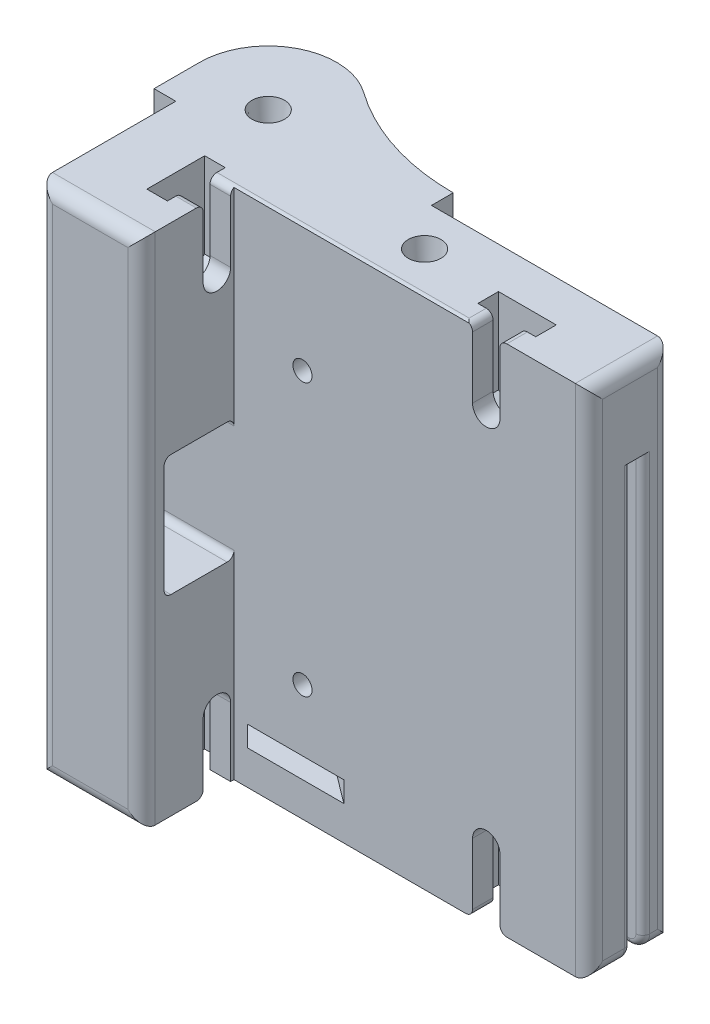
from build123d import *

# Parameters (mm, degrees)
BOSS_EXTRUDE1_DEPTH          = 75
SKETCH2_R                    = 2
CUT_EXTRUDE1_DEPTH           = 15
SKETCH4_R                    = 2
CUT_EXTRUDE2_DEPTH           = 12
SKETCH3_R                    = 2.3876
CUT_EXTRUDE3_DEPTH           = 6.35
CUT_EXTRUDE3_DRAFT           = -8
CUT_EXTRUDE3_PROFILE_2_DEPTH = 6.35
CUT_EXTRUDE3_PROFILE_2_DRAFT = -8
CUT_EXTRUDE4_START           = -3
CUT_EXTRUDE4_DEPTH           = 3
CUT_EXTRUDE5_START           = -3
CUT_EXTRUDE5_DEPTH           = 3
CUT_EXTRUDE6_START           = -3
CUT_EXTRUDE6_DEPTH           = 3
CUT_EXTRUDE7_START           = -3
CUT_EXTRUDE7_DEPTH           = 3
SKETCH9_R                    = 1.4951657
CUT_EXTRUDE8_DEPTH           = 5
MIRROR2_COPY_1_SKETCH_R      = 2.3876
MIRROR2_COPY_1_DEPTH         = 6.35
MIRROR2_COPY_1_DRAFT         = -8
MIRROR2_COPY_2_SKETCH_R      = 2.3876
MIRROR2_COPY_2_DEPTH         = 6.35
MIRROR2_COPY_2_DRAFT         = -8
MIRROR2_COPY_3_SKETCH_R      = 2.3876
MIRROR2_COPY_3_DEPTH         = 6.35
MIRROR2_COPY_3_DRAFT         = -8
FILLET2_START                = 9
FILLET2_DEPTH                = 4.666666667
FILLET2_START_2              = 4
FILLET2_2_DEPTH              = 39
FILLET3_R                    = 2
SKETCH10_W                   = 1.7
SKETCH10_H                   = 63
CUT_EXTRUDE9_DEPTH           = 5
FILLET4_R                    = 1
SKETCH11_W                   = 10.2
SKETCH11_H                   = 17.7
CUT_EXTRUDE10_DEPTH          = 15
SKETCH12_R                   = 1.397
CUT_EXTRUDE11_DEPTH          = 10
FILLET5_R                    = 1
CUT_EXTRUDE12_START          = -5
CUT_EXTRUDE12_DEPTH          = 3


with BuildPart() as part:
    # Sketch1 → Boss-Extrude1 (new body)
    with BuildSketch(Plane(origin=(0, 0, 0), x_dir=(1, 0, 0), z_dir=(0, 1, 0))):
        with BuildLine():
            Line((-6.825, -6.666666667), (-6.825, -26.666666667))
            Line((-6.825, -26.666666667), (8.175, -26.666666667))
            Line((8.175, -26.666666667), (8.175, -13.175))
            Line((8.175, -13.175), (60, -13.175))
            Line((60, -13.175), (60, -1.175))
            Line((60, -1.175), (25, -1.175))
            Line((25, -1.175), (25, 2))
            ThreePointArc((25, 2), (14.923352523, 3.572976633), (5.805515239, 8.142235123))
            ThreePointArc((5.805515239, 8.142235123), (3.047757271, 9.524241472), (0, 10))
            ThreePointArc((0, 10), (-7.071067812, 7.071067812), (-10, 0))
            Line((-10, 0), (-10, -6.666666667))
            Line((-10, -6.666666667), (-6.825, -6.666666667))
        make_face()
    extrude(amount=BOSS_EXTRUDE1_DEPTH)

    # Sketch2 → Cut-Extrude1 (cut)
    with BuildSketch(Plane.ZY.offset(6.825)):
        with Locations((15.666666667, 65)):
            Circle(SKETCH2_R)
    cut_extrude1 = extrude(amount=-CUT_EXTRUDE1_DEPTH, mode=Mode.SUBTRACT)

    # Sketch4 → Cut-Extrude2 (cut)
    with BuildSketch(Plane(origin=(0, 0, 1.175), x_dir=(-1, 0, 0), z_dir=(0, 0, -1))):
        with Locations((-45, 65)):
            Circle(SKETCH4_R)
    cut_extrude2 = extrude(amount=-CUT_EXTRUDE2_DEPTH, mode=Mode.SUBTRACT)


with BuildPart() as cut_extrude3_tool:
    # Sketch3 → Cut-Extrude3 (with draft: the straight prism first)
    with BuildSketch(Plane(origin=(0, 75, 0), x_dir=(1, 0, 0), z_dir=(0, 1, 0))):
        with Locations((1, -1)):
            Circle(SKETCH3_R)
    extrude(amount=-CUT_EXTRUDE3_DEPTH)
    # Cut-Extrude3: the draft: its side faces are tilted about the plane it starts from
    cut_extrude3_sides = [cut_extrude3_tool.faces().sort_by_distance(p)[0] for p in [
        (-1.3876, 71.825, 1),
    ]]
    draft(cut_extrude3_sides, Plane(origin=(0, 75, 0), x_dir=(1, 0, 0), z_dir=(0, 1, 0)), CUT_EXTRUDE3_DRAFT)


with BuildPart() as part_1:
    add(part.part)

    # Cut-Extrude3: cut by cut_extrude3_tool
    add(cut_extrude3_tool.part, mode=Mode.SUBTRACT)


with BuildPart() as cut_extrude3_profile_2_tool:
    # Sketch3 → Cut-Extrude3 profile 2 (with draft: the straight prism first)
    with BuildSketch(Plane(origin=(0, 75, 0), x_dir=(1, 0, 0), z_dir=(0, 1, 0))):
        with Locations((30, -7.175)):
            Circle(SKETCH3_R)
    extrude(amount=-CUT_EXTRUDE3_PROFILE_2_DEPTH)
    # Cut-Extrude3 profile 2: the draft: its side faces are tilted about the plane it starts from
    cut_extrude3_profile_2_sides = [cut_extrude3_profile_2_tool.faces().sort_by_distance(p)[0] for p in [
        (27.6124, 71.825, 7.175),
    ]]
    draft(cut_extrude3_profile_2_sides, Plane(origin=(0, 75, 0), x_dir=(1, 0, 0), z_dir=(0, 1, 0)), CUT_EXTRUDE3_PROFILE_2_DRAFT)


with BuildPart() as part_2:
    add(part_1.part)

    # Cut-Extrude3 profile 2: cut by cut_extrude3_profile_2_tool
    add(cut_extrude3_profile_2_tool.part, mode=Mode.SUBTRACT)

    # Sketch5 → Cut-Extrude4 (cut)
    with BuildSketch(Plane(origin=(8.175, 0, 0), x_dir=(0, 0, -1), z_dir=(1, 0, 0)).offset(CUT_EXTRUDE4_START)):
        Polygon((-19.885416667, 62.564303552), (-15.666666667, 60.128607104), (-11.447916667, 62.564303552), (-11.447916667, 75), (-19.885416667, 75), align=None)
    cut_extrude4 = extrude(amount=-CUT_EXTRUDE4_DEPTH, mode=Mode.SUBTRACT)

    # Sketch6 → Cut-Extrude5 (cut)
    with BuildSketch(Plane(origin=(8.175, 0, 0), x_dir=(0, 0, -1), z_dir=(1, 0, 0)).offset(CUT_EXTRUDE5_START)):
        with BuildLine():
            Line((-13.666666667, 65), (-13.666666667, 75))
            Line((-13.666666667, 75), (-17.666666667, 75))
            Line((-17.666666667, 75), (-17.666666667, 65))
            ThreePointArc((-17.666666667, 65), (-15.666666667, 67), (-13.666666667, 65))
        make_face()
    cut_extrude5 = extrude(amount=CUT_EXTRUDE5_DEPTH, mode=Mode.SUBTRACT)

    # Sketch7 → Cut-Extrude6 (cut)
    with BuildSketch(Plane.XY.offset(13.175).offset(CUT_EXTRUDE6_START)):
        Polygon((40.78125, 62.564303552), (45, 60.128607104), (49.21875, 62.564303552), (49.21875, 75), (40.78125, 75), align=None)
    cut_extrude6 = extrude(amount=-CUT_EXTRUDE6_DEPTH, mode=Mode.SUBTRACT)

    # Sketch8 → Cut-Extrude7 (cut)
    with BuildSketch(Plane.XY.offset(13.175).offset(CUT_EXTRUDE7_START)):
        with BuildLine():
            Line((47, 65), (47, 75))
            Line((47, 75), (43, 75))
            Line((43, 75), (43, 65))
            ThreePointArc((43, 65), (45, 67), (47, 65))
        make_face()
    cut_extrude7 = extrude(amount=CUT_EXTRUDE7_DEPTH, mode=Mode.SUBTRACT)

    # Sketch9 → Cut-Extrude8 (cut)
    with BuildSketch(Plane(origin=(0, 68.65, 0), x_dir=(1, 0, 0), z_dir=(0, 1, 0))):
        with Locations(Location((1, -1, 0), (0, 0, 270))):
            Circle(SKETCH9_R)
        with Locations(Location((30, -7.175, 0), (0, 0, 270))):
            Circle(SKETCH9_R)
    cut_extrude8 = extrude(amount=-CUT_EXTRUDE8_DEPTH, mode=Mode.SUBTRACT)

    # Mirror2: Cut-Extrude1, Cut-Extrude2, Cut-Extrude4, Cut-Extrude5, Cut-Extrude6, Cut-Extrude7, Cut-Extrude8 across plane
    add(cut_extrude1.mirror(Plane.ZX.offset(37.5)), mode=Mode.SUBTRACT)
    add(cut_extrude2.mirror(Plane.ZX.offset(37.5)), mode=Mode.SUBTRACT)
    add(cut_extrude4.mirror(Plane.ZX.offset(37.5)), mode=Mode.SUBTRACT)
    add(cut_extrude5.mirror(Plane.ZX.offset(37.5)), mode=Mode.SUBTRACT)
    add(cut_extrude6.mirror(Plane.ZX.offset(37.5)), mode=Mode.SUBTRACT)
    add(cut_extrude7.mirror(Plane.ZX.offset(37.5)), mode=Mode.SUBTRACT)
    add(cut_extrude8.mirror(Plane.ZX.offset(37.5)), mode=Mode.SUBTRACT)


with BuildPart() as mirror2_copy_1_tool:
    # Mirror2 copy 1 sketch → Mirror2 copy 1 (with draft: the straight prism first)
    with BuildSketch(Plane.XZ):
        with Locations((1, 1)):
            Circle(MIRROR2_COPY_1_SKETCH_R)
    extrude(amount=-MIRROR2_COPY_1_DEPTH)
    # Mirror2 copy 1: the draft: its side faces are tilted about the plane it starts from
    mirror2_copy_1_sides = [mirror2_copy_1_tool.faces().sort_by_distance(p)[0] for p in [
        (-1.3876, 3.175, 1),
    ]]
    draft(mirror2_copy_1_sides, Plane.XZ, MIRROR2_COPY_1_DRAFT)


with BuildPart() as part_3:
    add(part_2.part)

    # Mirror2 copy 1: cut by mirror2_copy_1_tool
    add(mirror2_copy_1_tool.part, mode=Mode.SUBTRACT)


with BuildPart() as mirror2_copy_2_tool:
    # Mirror2 copy 2 sketch → Mirror2 copy 2 (with draft: the straight prism first)
    with BuildSketch(Plane.XZ):
        with Locations((30, 7.175)):
            Circle(MIRROR2_COPY_2_SKETCH_R)
    extrude(amount=-MIRROR2_COPY_2_DEPTH)
    # Mirror2 copy 2: the draft: its side faces are tilted about the plane it starts from
    mirror2_copy_2_sides = [mirror2_copy_2_tool.faces().sort_by_distance(p)[0] for p in [
        (27.6124, 3.175, 7.175),
    ]]
    draft(mirror2_copy_2_sides, Plane.XZ, MIRROR2_COPY_2_DRAFT)


with BuildPart() as part_4:
    add(part_3.part)

    # Mirror2 copy 2: cut by mirror2_copy_2_tool
    add(mirror2_copy_2_tool.part, mode=Mode.SUBTRACT)


with BuildPart() as mirror2_copy_3_tool:
    # Mirror2 copy 3 sketch → Mirror2 copy 3 (with draft: the straight prism first)
    with BuildSketch(Plane.XZ):
        with Locations((30, 7.175)):
            Circle(MIRROR2_COPY_3_SKETCH_R)
    extrude(amount=-MIRROR2_COPY_3_DEPTH)
    # Mirror2 copy 3: the draft: its side faces are tilted about the plane it starts from
    mirror2_copy_3_sides = [mirror2_copy_3_tool.faces().sort_by_distance(p)[0] for p in [
        (27.6124, 3.175, 7.175),
    ]]
    draft(mirror2_copy_3_sides, Plane.XZ, MIRROR2_COPY_3_DRAFT)


with BuildPart() as part_5:
    add(part_4.part)

    # Mirror2 copy 3: cut by mirror2_copy_3_tool
    add(mirror2_copy_3_tool.part, mode=Mode.SUBTRACT)

    # Fillet2: read off the stored shape, not the designer's step
    # Fillet2 outline → Fillet2 (cut)
    with BuildSketch(Plane.XY.offset(FILLET2_START)):
        with BuildLine():
            Line((47, 1), (47, 0))
            Line((47, 0), (48, 0))
            ThreePointArc((48, 0), (47.292893219, 0.292893219), (47, 1))
        make_face()
        with BuildLine():
            Line((48, 75), (47, 75))
            Line((47, 75), (47, 74))
            ThreePointArc((47, 74), (47.292893219, 74.707106781), (48, 75))
        make_face()
        with BuildLine():
            Line((43, 75), (42, 75))
            ThreePointArc((42, 75), (42.707106781, 74.707106781), (43, 74))
            Line((43, 74), (43, 75))
        make_face()
        with BuildLine():
            ThreePointArc((43, 1), (42.707106781, 0.292893219), (42, 0))
            Line((42, 0), (43, 0))
            Line((43, 0), (43, 1))
        make_face()
    extrude(amount=FILLET2_DEPTH, mode=Mode.SUBTRACT)

    # Fillet2 2 outline → Fillet2 2 (cut)
    with BuildSketch(Plane.YZ.offset(FILLET2_START_2)):
        with BuildLine():
            Line((74, 17.666666667), (75, 17.666666667))
            Line((75, 17.666666667), (75, 18.666666667))
            ThreePointArc((75, 18.666666667), (74.707106782, 17.959559886), (74, 17.666666667))
        make_face()
        with BuildLine():
            ThreePointArc((74, 13.666666667), (74.707106781, 13.373773448), (75, 12.666666667))
            Line((75, 12.666666667), (75, 13.666666667))
            Line((75, 13.666666667), (74, 13.666666667))
        make_face()
        with BuildLine():
            ThreePointArc((1, 17.666666667), (0.292893218, 17.959559886), (0, 18.666666667))
            Line((0, 18.666666667), (0, 17.666666667))
            Line((0, 17.666666667), (1, 17.666666667))
        make_face()
    extrude(amount=FILLET2_2_DEPTH, mode=Mode.SUBTRACT)

    # Fillet3
    fillet3_edges = [part_5.edges().sort_by_distance(p)[0] for p in [
        (60, 0, 7.175),
        (0.675, 0, 26.666666667),
        (60, 37.5, 1.175),
        (60, 37.5, 13.175),
        (8.175, 37.5, 26.666666667),
        (-6.825, 37.5, 26.666666667),
        (0.675, 75, 26.666666667),
        (60, 75, 7.175),
    ]]
    fillet(fillet3_edges, radius=FILLET3_R)

    # Sketch10 → Cut-Extrude9 (cut)
    with BuildSketch(Plane(origin=(60, 0, 0), x_dir=(0, 0, -1), z_dir=(1, 0, 0))):
        with Locations((-6.175, 31.5)):
            Rectangle(SKETCH10_W, SKETCH10_H)
    extrude(amount=-CUT_EXTRUDE9_DEPTH, mode=Mode.SUBTRACT)

    # Fillet4
    fillet4_edges = [part_5.edges().sort_by_distance(p)[0] for p in [
        (59.414213562, 0.585786438, 7.025),
        (59.414213562, 0.585786438, 5.325),
        (60, 32.5, 7.025),
        (60, 32.5, 5.325),
        (55, 0, 6.175),
        (56.5, 0, 5.325),
        (56.5, 0, 7.025),
    ]]
    fillet(fillet4_edges, radius=FILLET4_R)

    # Sketch11 → Cut-Extrude10 (cut)
    with BuildSketch(Plane(origin=(8.175, 0, 0), x_dir=(0, 0, -1), z_dir=(1, 0, 0))):
        with Locations((-18.275, 36.85)):
            Rectangle(SKETCH11_W, SKETCH11_H)
    extrude(amount=-CUT_EXTRUDE10_DEPTH, mode=Mode.SUBTRACT)

    # Sketch12 → Cut-Extrude11 (cut)
    with BuildSketch(Plane.XY.offset(13.175)):
        with Locations((18.175, 17)):
            Circle(SKETCH12_R)
        with Locations((18.175, 56.7)):
            Circle(SKETCH12_R)
    extrude(amount=-CUT_EXTRUDE11_DEPTH, mode=Mode.SUBTRACT)

    # Fillet5
    fillet5_edges = [part_5.edges().sort_by_distance(p)[0] for p in [
        (0.675, 45.7, 13.175),
        (0.675, 28, 13.175),
        (0.675, 28, 23.375),
        (0.675, 45.7, 23.375),
    ]]
    fillet(fillet5_edges, radius=FILLET5_R)

    # Sketch13 → Cut-Extrude12 (cut)
    with BuildSketch(Plane.XZ.offset(CUT_EXTRUDE12_START)):
        Polygon((-2.893869279, -1.927157459), (1.588058081, -3.835768444), (5.48192736, -0.908610985), (24.216737808, 13.175), (10.175, 13.175), (0.411941919, 5.835768444), (-3.48192736, 2.908610985), align=None)
    extrude(amount=-CUT_EXTRUDE12_DEPTH, mode=Mode.SUBTRACT)


solid = part_5.part
